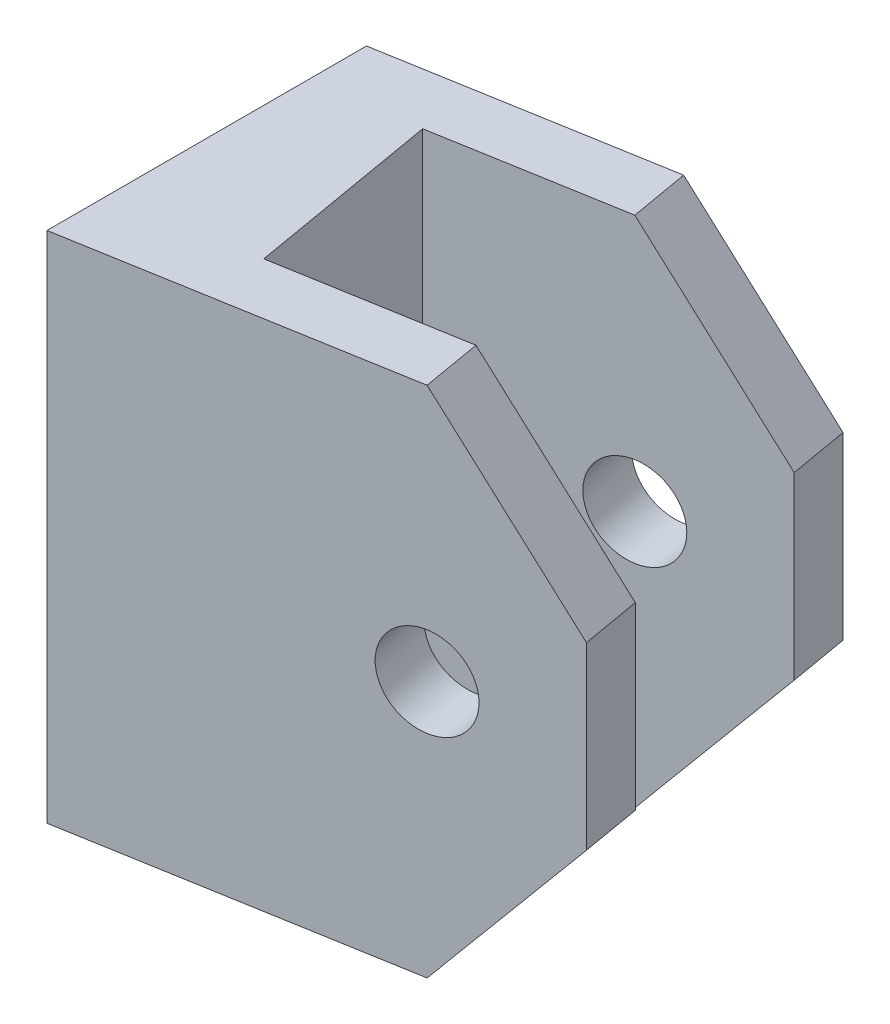
from build123d import *

# Parameters (mm, degrees)
BOSS_EXTRUDE1_DEPTH = 54.37886
SKETCH6_R           = 4.7625
CUT_EXTRUDE2_DEPTH  = 81.210956189


with BuildPart() as part:
    # Sketch1 → Boss-Extrude1 (new body)
    with BuildSketch(Plane(origin=(0, 0, 0), x_dir=(1, 0, 0), z_dir=(0, 1, 0))):
        Polygon((0, 0), (0, -30.527895874), (0, -33.845088532), (48.720611738, -25.420719239), (47.63867672, -19.163569998), (14.087086629, -24.965036261), (10.568633951, -4.616786931), (44.120224042, 1.184679332), (43.038289025, 7.441828572), align=None)
    extrude(amount=BOSS_EXTRUDE1_DEPTH)

    # Sketch6 → Cut-Extrude2 (cut, through all)
    with BuildSketch(Plane(origin=(5.682322713, 0, 32.862547811), x_dir=(0.985377833144202, 0, -0.17038346735536675), z_dir=(0.17038346735536675, 0, 0.985377833144202))):
        with Locations((29.071940537, 27.18943)):
            Circle(SKETCH6_R)
        Polygon((43.676940537, 36.71443), (29.071940537, 54.37886), (43.676940537, 54.37886), align=None)
        Polygon((43.676940537, 0), (43.676940537, 17.66443), (29.071940537, 0), align=None)
    extrude(amount=-CUT_EXTRUDE2_DEPTH, mode=Mode.SUBTRACT)


solid = part.part
